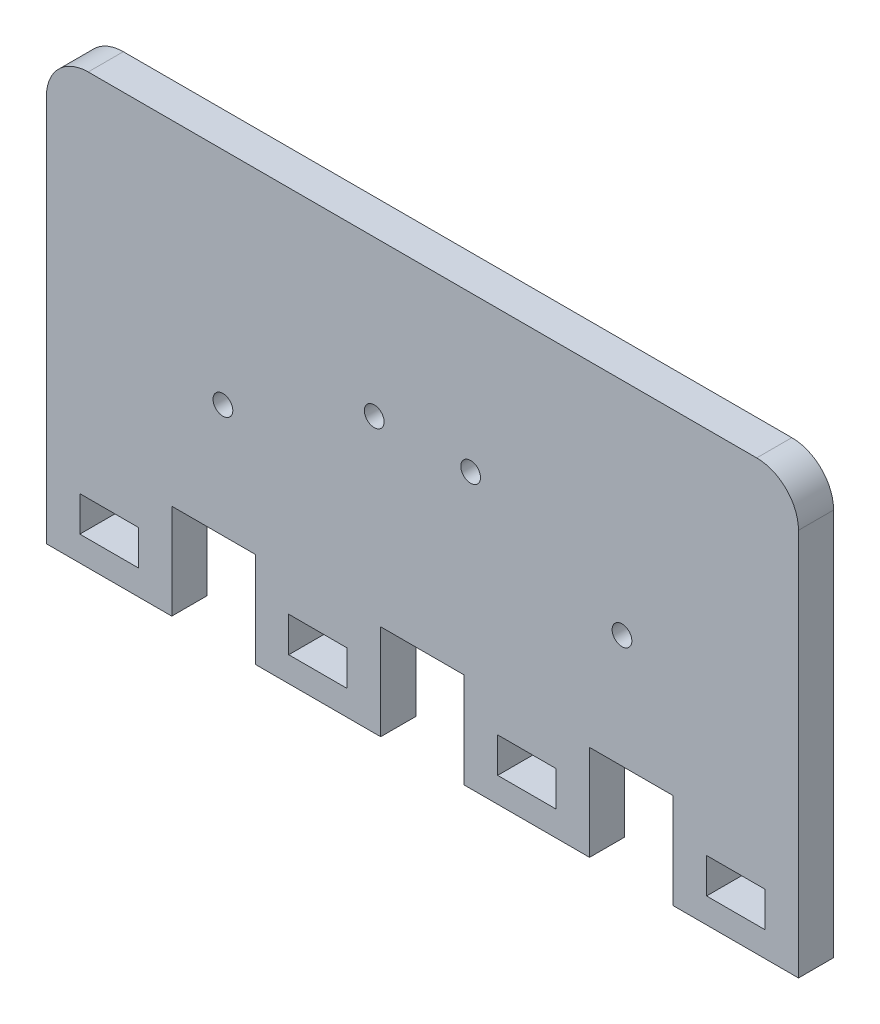
from build123d import *

# Parameters (mm, degrees)
SKETCH1_W           = 114.3
SKETCH1_H           = 56.134
BOSS_EXTRUDE1_DEPTH = 5.334
SKETCH2_W           = 12.7
SKETCH2_H           = 5.334
CUT_EXTRUDE1_DEPTH  = 90.417531181
FILLET1_R           = 6.35
SKETCH3_R           = 1.5
CUT_EXTRUDE2_DEPTH  = 90.417531181
SKETCH4_W           = 19.05
SKETCH4_H           = 5.334
BOSS_EXTRUDE2_DEPTH = 9.144
SKETCH6_W           = 8.89
SKETCH6_H           = 5.334
CUT_EXTRUDE3_DEPTH  = 93.966642796


with BuildPart() as part:
    # Sketch1 → Boss-Extrude1 (new body)
    with BuildSketch(Plane.XY):
        with Locations((26.61749153, -2.755892293)):
            Rectangle(SKETCH1_W, SKETCH1_H)
    extrude(amount=BOSS_EXTRUDE1_DEPTH)

    # Sketch2 → Cut-Extrude1 (cut, through all)
    with BuildSketch(Plane.XY.offset(5.334)):
        with Locations((-5.13250847, -28.155892293)):
            Rectangle(SKETCH2_W, SKETCH2_H)
        with Locations((26.61749153, -28.155892293)):
            Rectangle(SKETCH2_W, SKETCH2_H)
        with Locations((58.36749153, -28.155892293)):
            Rectangle(SKETCH2_W, SKETCH2_H)
    extrude(amount=-CUT_EXTRUDE1_DEPTH, mode=Mode.SUBTRACT)

    # Fillet1
    fillet1_edges = [part.edges().sort_by_distance(p)[0] for p in [
        (83.76749153, 25.311107707, 2.667),
        (-30.53250847, 25.311107707, 2.667),
    ]]
    fillet(fillet1_edges, radius=FILLET1_R)

    # Sketch3 → Cut-Extrude2 (cut, through all)
    with BuildSketch(Plane(origin=(0, 0, 0), x_dir=(-1, 0, 0), z_dir=(0, 0, -1))):
        with Locations((3.70850847, -8.264892293)):
            Circle(SKETCH3_R)
        with Locations((-19.29149153, 1.735107707)):
            Circle(SKETCH3_R)
        with Locations((-56.94349153, -8.264892293)):
            Circle(SKETCH3_R)
        with Locations((-33.94349153, 1.735107707)):
            Circle(SKETCH3_R)
    extrude(amount=-CUT_EXTRUDE2_DEPTH, mode=Mode.SUBTRACT)

    # Sketch4 → Boss-Extrude2 (add)
    with BuildSketch(Plane(origin=(0, -30.822892293, 0), x_dir=(-1, 0, 0), z_dir=(0, -1, 0))):
        with Locations((-10.74249153, -2.667)):
            Rectangle(SKETCH4_W, SKETCH4_H)
        with Locations((21.00750847, -2.667)):
            Rectangle(SKETCH4_W, SKETCH4_H)
        with Locations((-42.49249153, -2.667)):
            Rectangle(SKETCH4_W, SKETCH4_H)
        with Locations((-74.24249153, -2.667)):
            Rectangle(SKETCH4_W, SKETCH4_H)
    extrude(amount=BOSS_EXTRUDE2_DEPTH)

    # Sketch6 → Cut-Extrude3 (cut, through all)
    with BuildSketch(Plane.XY.offset(5.334)):
        with Locations((-21.00750847, -33.489892293)):
            Rectangle(SKETCH6_W, SKETCH6_H)
        with Locations((10.74249153, -33.489892293)):
            Rectangle(SKETCH6_W, SKETCH6_H)
        with Locations((42.49249153, -33.489892293)):
            Rectangle(SKETCH6_W, SKETCH6_H)
        with Locations((74.24249153, -33.489892293)):
            Rectangle(SKETCH6_W, SKETCH6_H)
    extrude(amount=-CUT_EXTRUDE3_DEPTH, mode=Mode.SUBTRACT)


solid = part.part
